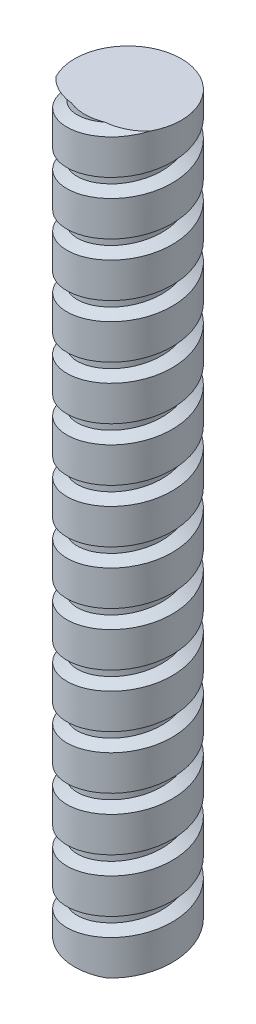
from build123d import *

# Parameters (mm, degrees)
ESBO_O1_R                 = 4
RESSALTO_EXTRUS_O1_DEPTH  = 27.5
VARREDURA_DE_CORTE1_PITCH = 4
ESBO_O4_R                 = 2.55
CORTE_EXTRUS_O1_DEPTH     = 20


with BuildPart() as part:
    # Esboço1 → Ressalto-extrusão1 (new, symmetric)
    with BuildSketch(Plane(origin=(0, 0, 0), x_dir=(1, 0, 0), z_dir=(0, 1, 0))):
        with Locations(Location((0, 0, 0), (0, 0, 270))):
            Circle(ESBO_O1_R)
    extrude(amount=RESSALTO_EXTRUS_O1_DEPTH, both=True)

    # Varredura de corte1: arcs per turn and ends read off the stored shape
    # Varredura de corte1: the profile of Esboço3 profile screwed along a right-hand helix through 27.375 turns, 12 arcs to a turn; built about Z, then put on its axis
    varredura_de_corte1_z = Axis((0, 0, 0), (0, 0, 1))
    varredura_de_corte1_corners = [(4.0003, 0, -3.314842863), (4.0003, 0, -4.68515695), (3.24, 0, -4.254999907), (3.24, 0, -3.744999907)]
    with BuildLine(mode=Mode.PRIVATE) as varredura_de_corte1_profile:
        Line(varredura_de_corte1_corners[0], varredura_de_corte1_corners[1])
        Line(varredura_de_corte1_corners[1], varredura_de_corte1_corners[2])
        Line(varredura_de_corte1_corners[2], varredura_de_corte1_corners[3])
        Line(varredura_de_corte1_corners[3], varredura_de_corte1_corners[0])
    varredura_de_corte1_cap = Face(varredura_de_corte1_profile.wire())
    varredura_de_corte1_turn_angles = [0, 15, 30, 45, 60, 75, 90, 105, 120, 135, 150, 165, 180, 195, 210, 225, 240, 255, 270, 285, 300, 315, 330, 345, 360]
    varredura_de_corte1_turn_weights = [1, 0.9659258262890683, 1, 0.9659258262890683, 1, 0.9659258262890683, 1, 0.9659258262890683, 1, 0.9659258262890683, 1, 0.9659258262890683, 1, 0.9659258262890683, 1, 0.9659258262890683, 1, 0.9659258262890683, 1, 0.9659258262890683, 1, 0.9659258262890683, 1, 0.9659258262890683, 1]
    varredura_de_corte1_turn_rails = [Edge.make_bspline([Vector(p[0], p[1], 0).rotate(varredura_de_corte1_z, varredura_de_corte1_turn_angles[k]) / varredura_de_corte1_turn_weights[k] + Vector(0, 0, p[2] + VARREDURA_DE_CORTE1_PITCH * varredura_de_corte1_turn_angles[k] / 360) for k in range(25)], [0, 0, 0, 1, 1, 2, 2, 3, 3, 4, 4, 5, 5, 6, 6, 7, 7, 8, 8, 9, 9, 10, 10, 11, 11, 12, 12, 12], 2, varredura_de_corte1_turn_weights) for p in varredura_de_corte1_corners]
    varredura_de_corte1_turn_sides = [Face.make_surface_from_curves(varredura_de_corte1_turn_rails[p[0]], varredura_de_corte1_turn_rails[p[1]]) for p in [(0, 1), (1, 2), (2, 3), (3, 0)]]
    varredura_de_corte1_last_angles = [9720, 9735, 9750, 9765, 9780, 9795, 9810, 9825, 9840, 9847.5, 9855]
    varredura_de_corte1_last_weights = [1, 0.9659258262890683, 1, 0.9659258262890683, 1, 0.9659258262890683, 1, 0.9659258262890683, 1, 0.9914448613738104, 1]
    varredura_de_corte1_last_rails = [Edge.make_bspline([Vector(p[0], p[1], 0).rotate(varredura_de_corte1_z, varredura_de_corte1_last_angles[k]) / varredura_de_corte1_last_weights[k] + Vector(0, 0, p[2] + VARREDURA_DE_CORTE1_PITCH * varredura_de_corte1_last_angles[k] / 360) for k in range(11)], [0, 0, 0, 1, 1, 2, 2, 3, 3, 4, 4, 5, 5, 5], 2, varredura_de_corte1_last_weights) for p in varredura_de_corte1_corners]
    varredura_de_corte1_last_sides = [Face.make_surface_from_curves(varredura_de_corte1_last_rails[p[0]], varredura_de_corte1_last_rails[p[1]]) for p in [(0, 1), (1, 2), (2, 3), (3, 0)]]
    varredura_de_corte1 = Plane(origin=(0, -27.5, 0), x_dir=(1, 0, 0), z_dir=(0, 1, 0)) * Solid(Shell([*[p.moved(Location((0, 0, VARREDURA_DE_CORTE1_PITCH * i))) for i in range(27) for p in varredura_de_corte1_turn_sides], *varredura_de_corte1_last_sides, varredura_de_corte1_cap, varredura_de_corte1_cap.rotate(varredura_de_corte1_z, 9855).moved(Location((0, 0, VARREDURA_DE_CORTE1_PITCH * 9855 / 360)))]))
    add(varredura_de_corte1, mode=Mode.SUBTRACT)

    # Esboço4 → Corte-extrusão1 (cut)
    with BuildSketch(Plane(origin=(0, -27.5, 0), x_dir=(-1, 0, 0), z_dir=(0, -1, 0))):
        with Locations(Location((0, 0, 0), (0, 0, 90))):
            Circle(ESBO_O4_R)
    extrude(amount=-CORTE_EXTRUS_O1_DEPTH, mode=Mode.SUBTRACT)


solid = part.part
